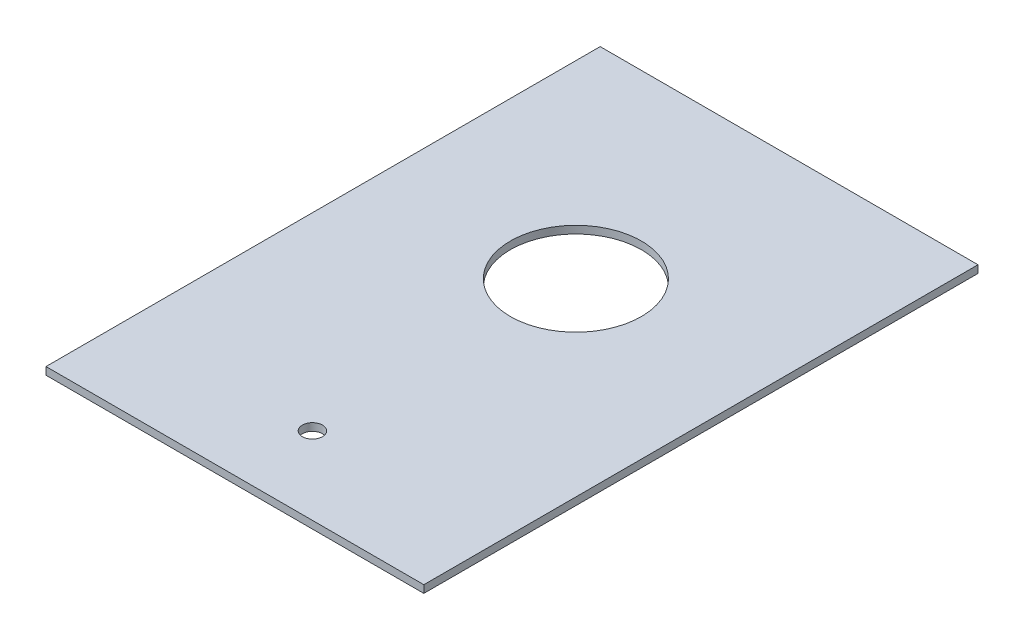
from build123d import *

# Parameters (mm, degrees)
SKETCH1_W           = 150
SKETCH1_H           = 220
BOSS_EXTRUDE1_DEPTH = 3
HOLE1_D             = 52
HOLE1_DEPTH         = 10
HOLE2_D             = 8
HOLE2_DEPTH         = 100


with BuildPart() as part:
    # Sketch1 → Boss-Extrude1 (new body)
    with BuildSketch(Plane(origin=(0, 0, 0), x_dir=(1, 0, 0), z_dir=(0, 1, 0))):
        with Locations((0, -25.362515428)):
            Rectangle(SKETCH1_W, SKETCH1_H)
    extrude(amount=-BOSS_EXTRUDE1_DEPTH)

    # Hole1
    with Locations(Plane(origin=(0, 0, 0), x_dir=(1, 0, 0), z_dir=(0, 1, 0))):
        with Locations((0, 0)):
            Hole(HOLE1_D / 2, depth=HOLE1_DEPTH)

    # Hole2
    with Locations(Plane(origin=(0, 0, 0), x_dir=(1, 0, 0), z_dir=(0, 1, 0))):
        with Locations((0, -104.6)):
            Hole(HOLE2_D / 2, depth=HOLE2_DEPTH)


solid = part.part
